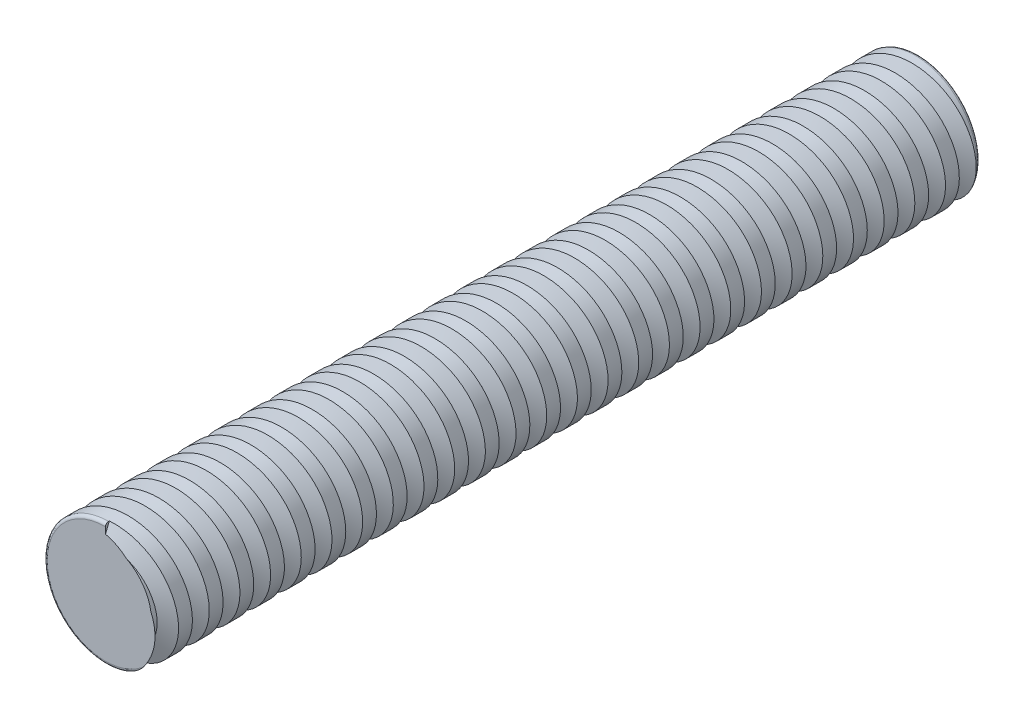
from build123d import *

# Parameters (mm, degrees)
SKETCH1_R           = 4
BOSS_EXTRUDE1_DEPTH = 53
FILLET1_R           = 0.2
CUT_SWEEP1_PITCH    = 2


with BuildPart() as part:
    # Sketch1 → Boss-Extrude1 (new body)
    with BuildSketch(Plane.XY):
        Circle(SKETCH1_R)
    extrude(amount=-BOSS_EXTRUDE1_DEPTH)

    # Fillet1
    fillet1_edges = [part.edges().sort_by_distance(p)[0] for p in [
        (-4, 0, 0),
        (-4, 0, -53),
    ]]
    fillet(fillet1_edges, radius=FILLET1_R)

    # Cut-Sweep1: arcs per turn and ends read off the stored shape
    # Cut-Sweep1: the profile of Sketch3 screwed along a right-hand helix through 100 turns, 6 arcs to a turn; built about Z, then put on its axis
    cut_sweep1_z = Axis((0, 0, 0), (0, 0, 1))
    cut_sweep1_corners = [(3, -2.094e-06, -0.150000222), (3, -2.094e-06, -0.450000222), (5, -3.491e-06, -1.250000222), (5, -3.491e-06, 0.649999778)]
    with BuildLine(mode=Mode.PRIVATE) as cut_sweep1_profile:
        Line(cut_sweep1_corners[0], cut_sweep1_corners[1])
        Line(cut_sweep1_corners[1], cut_sweep1_corners[2])
        Line(cut_sweep1_corners[2], cut_sweep1_corners[3])
        Line(cut_sweep1_corners[3], cut_sweep1_corners[0])
    cut_sweep1_cap = Face(cut_sweep1_profile.wire())
    cut_sweep1_turn_angles = [0, 30, 60, 90, 120, 150, 180, 210, 240, 270, 300, 330, 360]
    cut_sweep1_turn_weights = [1, 0.8660254037844387, 1, 0.8660254037844387, 1, 0.8660254037844387, 1, 0.8660254037844387, 1, 0.8660254037844387, 1, 0.8660254037844387, 1]
    cut_sweep1_turn_rails = [Edge.make_bspline([Vector(p[0], p[1], 0).rotate(cut_sweep1_z, cut_sweep1_turn_angles[k]) / cut_sweep1_turn_weights[k] + Vector(0, 0, p[2] + CUT_SWEEP1_PITCH * cut_sweep1_turn_angles[k] / 360) for k in range(13)], [0, 0, 0, 1, 1, 2, 2, 3, 3, 4, 4, 5, 5, 6, 6, 6], 2, cut_sweep1_turn_weights) for p in cut_sweep1_corners]
    cut_sweep1_turn_sides = [Face.make_surface_from_curves(cut_sweep1_turn_rails[p[0]], cut_sweep1_turn_rails[p[1]]) for p in [(0, 1), (1, 2), (2, 3), (3, 0)]]
    cut_sweep1 = Plane(origin=(0, 0, 0), x_dir=(0, 1, 0), z_dir=(0, 0, -1)) * Solid(Shell([*[p.moved(Location((0, 0, CUT_SWEEP1_PITCH * i))) for i in range(100) for p in cut_sweep1_turn_sides], cut_sweep1_cap, cut_sweep1_cap.rotate(cut_sweep1_z, 36000).moved(Location((0, 0, CUT_SWEEP1_PITCH * 36000 / 360)))]))
    add(cut_sweep1, mode=Mode.SUBTRACT)


solid = part.part
